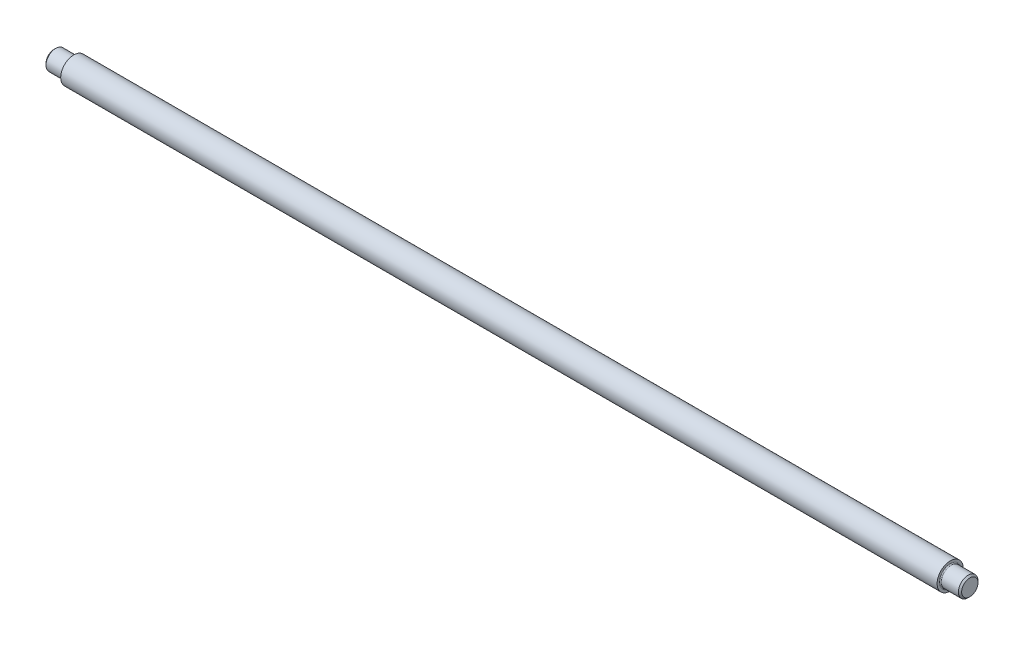
from build123d import *


with BuildPart() as part:
    # Sketch1 → Revolve1 (revolve)
    with BuildSketch(Plane.XY):
        with BuildLine():
            Line((0, 2.5), (0, 0))
            Line((0, 0), (280, 0))
            Line((280, 0), (280, 2.5))
            Line((280, 2.5), (279.5, 3))
            Line((279.5, 3), (274.3, 3))
            ThreePointArc((274.3, 3), (274.087867966, 3.087867966), (274, 3.3))
            Line((274, 3.3), (274, 4))
            Line((274, 4), (6, 4))
            Line((6, 4), (6, 3.3))
            ThreePointArc((6, 3.3), (5.912132034, 3.087867966), (5.7, 3))
            Line((5.7, 3), (0.5, 3))
            Line((0.5, 3), (0, 2.5))
        make_face()
    revolve(axis=Axis((0, 0, 0), (1, 0, 0)))


solid = part.part
